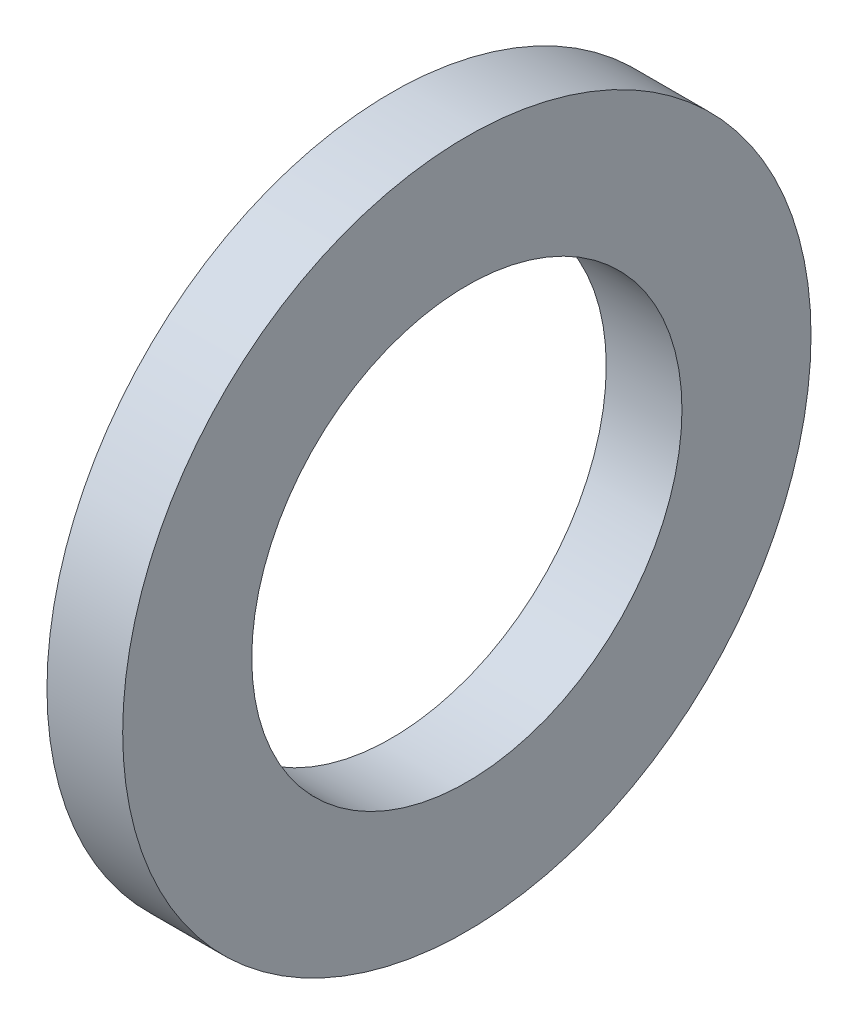
from build123d import *

# Parameters (mm, degrees)
SKETCH1_R           = 6.35
SKETCH1_R_2         = 3.96875
BOSS_EXTRUDE1_DEPTH = 1.397


with BuildPart() as part:
    # Sketch1 → Boss-Extrude1 (new body)
    with BuildSketch(Plane(origin=(0, 0, 0), x_dir=(0, 0, -1), z_dir=(1, 0, 0))):
        Circle(SKETCH1_R)
        Circle(SKETCH1_R_2, mode=Mode.SUBTRACT)
    extrude(amount=BOSS_EXTRUDE1_DEPTH)


solid = part.part
